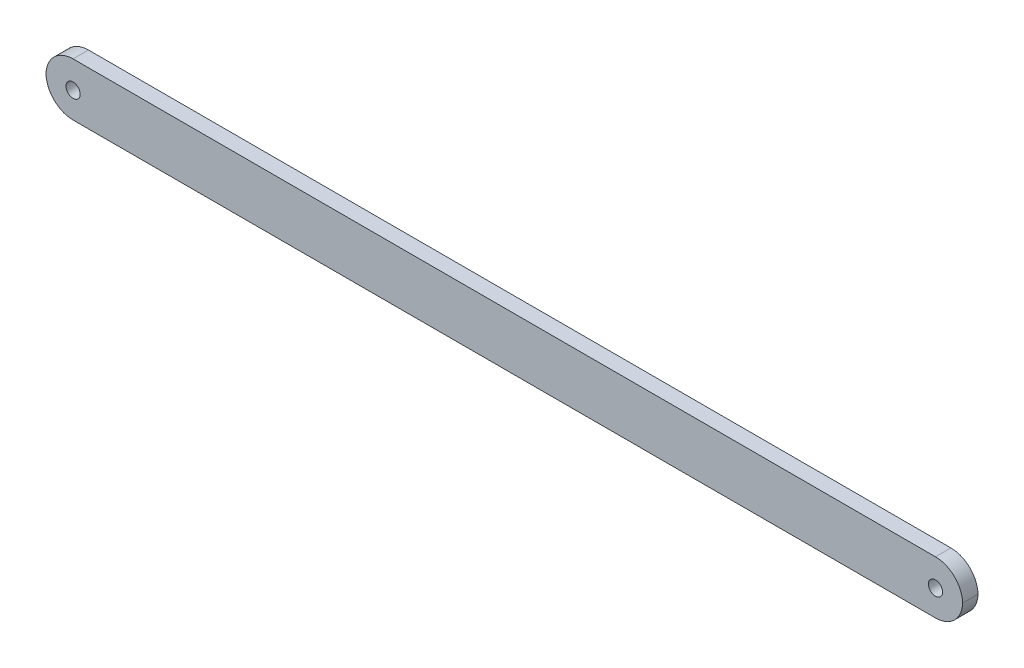
from build123d import *

# Parameters (mm, degrees)
SKETCH1_W           = 188.976
SKETCH1_H           = 10.922
BOSS_EXTRUDE1_DEPTH = 3.175
FILLET1_R           = 5.588
SKETCH2_R           = 1.4605
CUT_EXTRUDE1_DEPTH  = 95.697479006


with BuildPart() as part:
    # Sketch1 → Boss-Extrude1 (new body)
    with BuildSketch(Plane.XY):
        Rectangle(SKETCH1_W, SKETCH1_H)
    extrude(amount=BOSS_EXTRUDE1_DEPTH)

    # Fillet1
    # the kernel refuses this fillet: 5.588 mm, written as the material it takes off along each edge
    with BuildSketch(Plane(origin=(-94.488, -5.461, -13.97), x_dir=(1, 0, 0), z_dir=(0, 0, 1))) as fillet1_piece_1:
        with BuildLine():
            CenterArc((FILLET1_R, FILLET1_R), FILLET1_R, 180, 90)
            Line((0, FILLET1_R), (0, 0))
            Line((0, 0), (FILLET1_R, 0))
        make_face()
    extrude(amount=31.115, mode=Mode.SUBTRACT)
    with BuildSketch(Plane(origin=(-94.488, 5.461, -13.97), x_dir=(1, 0, 0), z_dir=(0, 0, 1)), Plane(origin=(94.488, -5.461, -13.97), x_dir=(-1, 0, 0), z_dir=(0, 0, 1)), Plane(origin=(94.488, 5.461, -13.97), x_dir=(0, -1, 0), z_dir=(0, 0, 1))) as fillet1_piece_2:
        with BuildLine():
            CenterArc((FILLET1_R, -FILLET1_R), FILLET1_R, 90, 90)
            Line((0, -FILLET1_R), (0, 0))
            Line((0, 0), (FILLET1_R, 0))
        make_face()
    extrude(amount=31.115, mode=Mode.SUBTRACT)

    # Sketch2 → Cut-Extrude1 (cut, through all)
    with BuildSketch(Plane.XY.offset(3.175)):
        with Locations((-88.9, -0.127)):
            Circle(SKETCH2_R)
        with Locations((88.9, -0.127)):
            Circle(SKETCH2_R)
    extrude(amount=-CUT_EXTRUDE1_DEPTH, mode=Mode.SUBTRACT)


solid = part.part
